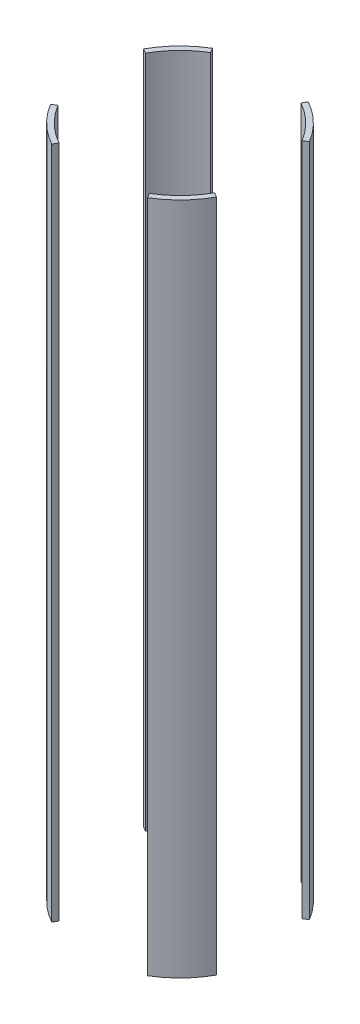
from build123d import *

# Parameters (mm, degrees)
SKETCH2_R               = 88.9
SKETCH2_R_2             = 83.82
BOSS_EXTRUDE1_DEPTH     = 317.5
CUT_EXTRUDE1_DEPTH      = 342.485973358
CUT_EXTRUDE1_DEPTH_BACK = 342.485973358


with BuildPart() as part:
    # Sketch2 → Boss-Extrude1 (new, symmetric)
    with BuildSketch(Plane(origin=(0, 0, 0), x_dir=(1, 0, 0), z_dir=(0, 1, 0))):
        Circle(SKETCH2_R)
        Circle(SKETCH2_R_2, mode=Mode.SUBTRACT)
    extrude(amount=BOSS_EXTRUDE1_DEPTH, both=True)

    # Sketch3 → Cut-Extrude1 (cut, two sides: drawn at the far end of the back side and taken through both)
    with BuildSketch(Plane(origin=(0, 0, 0), x_dir=(1, 0, 0), z_dir=(0, 1, 0)).offset(-CUT_EXTRUDE1_DEPTH_BACK)):
        Polygon((-58.116685864, 96.974944394), (0, 0), (53.900027233, 96.974944394), align=None)
        Polygon((70.991745134, -118.45858783), (0, 0), (-65.840936026, -118.45858783), align=None)
        Polygon((169.661755759, 101.677593364), (0, 0), (169.661755759, -94.300371224), align=None)
        Polygon((-123.741299607, -74.157652604), (0, 0), (-123.741299607, 68.777140945), align=None)
    extrude(amount=CUT_EXTRUDE1_DEPTH + CUT_EXTRUDE1_DEPTH_BACK, mode=Mode.SUBTRACT)


with BuildPart() as cut_extrude1_piece_1:
    # of the separate pieces the step leaves, piece 1, a body of its own (cut_extrude1_pieces)
    add(part.part.solids().sort_by_distance((-45.699187432, -317.5, -76.254798328))[0])


with BuildPart() as cut_extrude1_piece_2:
    # of the separate pieces the step leaves, piece 2, a body of its own (cut_extrude1_pieces)
    add(part.part.solids().sort_by_distance((45.699187432, -317.5, 76.254798328))[0])


with BuildPart() as cut_extrude1_piece_3:
    # of the separate pieces the step leaves, piece 3, a body of its own (cut_extrude1_pieces)
    add(part.part.solids().sort_by_distance((76.254798328, -317.5, -45.699187432))[0])


with BuildPart() as cut_extrude1_piece_4:
    # of the separate pieces the step leaves, piece 4, a body of its own (cut_extrude1_pieces)
    add(part.part.solids().sort_by_distance((-76.254798328, -317.5, 45.699187432))[0])


solid = Compound([cut_extrude1_piece_1.part, cut_extrude1_piece_2.part, cut_extrude1_piece_3.part, cut_extrude1_piece_4.part])
